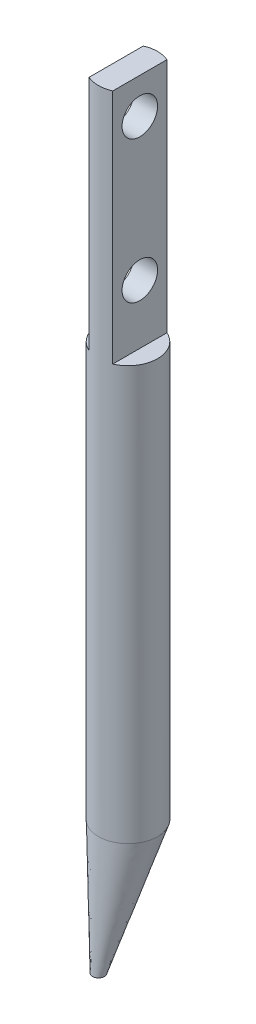
from build123d import *

# Parameters (mm, degrees)
SKETCH1_R               = 2.5
BOSS_EXTRUDE1_DEPTH     = 35
BOSS_EXTRUDE3_DEPTH     = 20
CUT_EXTRUDE1_DEPTH      = 56.192843751
CUT_EXTRUDE1_DEPTH_BACK = 56.192843751
SKETCH5_R               = 1.5


with BuildPart() as part:
    # Sketch1 → Boss-Extrude1 (new body)
    with BuildSketch(Plane(origin=(0, 0, 0), x_dir=(1, 0, 0), z_dir=(0, 1, 0))):
        with Locations(Location((0, 0, 0), (0, 0, 270))):
            Circle(SKETCH1_R)
    extrude(amount=BOSS_EXTRUDE1_DEPTH)

    # Loft1: read off the stored shape, not the designer's step
    # Loft1: loft between two sections, ruled curve by curve
    loft1_from = [
        Edge.make_bspline([(0.230578893, 0, -2.489343965), (0.438024223, 0, -2.470129057), (0.670349848, 0, -2.423167801), (1.166394246, 0, -2.227248431), (1.430985782, 0, -2.076870435), (1.925153205, 0, -1.629385237), (2.153143915, 0, -1.329570714), (2.380909567, 0, -0.787220671), (2.437565935, 0, -0.59190362), (2.50144736, 0, -0.186651247), (2.508558872, 0, 0.023133562), (2.470129057, 0, 0.438024223), (2.42460592, 0, 0.642933676), (2.287375849, 0, 1.029557822), (2.195808172, 0, 1.211145418), (1.87230042, 0, 1.702433007), (1.593119599, 0, 1.955270072), (1.02516693, 0, 2.304374943), (0.737456018, 0, 2.403595168), (0.213865128, 0, 2.505069424), (-0.023133562, 0, 2.508558872), (-0.438024223, 0, 2.470129057), (-0.670349848, 0, 2.423167801), (-1.166394246, 0, 2.227248431), (-1.430985782, 0, 2.076870435), (-1.925153205, 0, 1.629385237), (-2.153143915, 0, 1.329570714), (-2.380909567, 0, 0.787220671), (-2.437565935, 0, 0.59190362), (-2.50144736, 0, 0.186651247), (-2.508558872, 0, -0.023133562), (-2.470129057, 0, -0.438024223), (-2.42460592, 0, -0.642933676), (-2.287375849, 0, -1.029557822), (-2.195808172, 0, -1.211145418), (-1.87230042, 0, -1.702433007), (-1.593119599, 0, -1.955270072), (-1.02516693, 0, -2.304374943), (-0.737456018, 0, -2.403595168), (-0.213865128, 0, -2.505069424), (0.023133562, 0, -2.508558872), (0.230578893, 0, -2.489343965)], [0, 0, 0, 0, 0.0625, 0.0625, 0.125, 0.125, 0.1875, 0.1875, 0.21875, 0.21875, 0.25, 0.25, 0.28125, 0.28125, 0.3125, 0.3125, 0.375, 0.375, 0.4375, 0.4375, 0.5, 0.5, 0.5625, 0.5625, 0.625, 0.625, 0.6875, 0.6875, 0.71875, 0.71875, 0.75, 0.75, 0.78125, 0.78125, 0.8125, 0.8125, 0.875, 0.875, 0.9375, 0.9375, 1, 1, 1, 1], 3),
    ]
    loft1_to = [
        Edge.make_bspline([(0, -10, 2), (0.041666667, -10, 2), (0.0888, -10, 2.005066667), (0.1912, -10, 2.034933333), (0.246666667, -10, 2.06), (0.353333333, -10, 2.14), (0.404267589, -10, 2.19550173), (0.459630911, -10, 2.299307958), (0.474336794, -10, 2.337298155), (0.494521338, -10, 2.416810842), (0.5, -10, 2.458333333), (0.5, -10, 2.541666667), (0.494521338, -10, 2.583189158), (0.474336794, -10, 2.662701845), (0.459630911, -10, 2.700692042), (0.404267589, -10, 2.80449827), (0.353333333, -10, 2.86), (0.246666667, -10, 2.94), (0.1912, -10, 2.965066667), (0.0888, -10, 2.994933333), (0.041666667, -10, 3), (-0.041666667, -10, 3), (-0.0888, -10, 2.994933333), (-0.1912, -10, 2.965066667), (-0.246666667, -10, 2.94), (-0.353333333, -10, 2.86), (-0.404267589, -10, 2.80449827), (-0.459630911, -10, 2.700692042), (-0.474336794, -10, 2.662701845), (-0.494521338, -10, 2.583189158), (-0.5, -10, 2.541666667), (-0.5, -10, 2.458333333), (-0.494521338, -10, 2.416810842), (-0.474336794, -10, 2.337298155), (-0.459630911, -10, 2.299307958), (-0.404267589, -10, 2.19550173), (-0.353333333, -10, 2.14), (-0.246666667, -10, 2.06), (-0.1912, -10, 2.034933333), (-0.0888, -10, 2.005066667), (-0.041666667, -10, 2), (0, -10, 2)], [0, 0, 0, 0, 0.0625, 0.0625, 0.125, 0.125, 0.1875, 0.1875, 0.21875, 0.21875, 0.25, 0.25, 0.28125, 0.28125, 0.3125, 0.3125, 0.375, 0.375, 0.4375, 0.4375, 0.5, 0.5, 0.5625, 0.5625, 0.625, 0.625, 0.6875, 0.6875, 0.71875, 0.71875, 0.75, 0.75, 0.78125, 0.78125, 0.8125, 0.8125, 0.875, 0.875, 0.9375, 0.9375, 1, 1, 1, 1], 3),
    ]
    loft1 = Solid(Shell([*[Face.make_surface_from_curves(loft1_from[k], loft1_to[k]) for k in range(1)], Face(Wire(loft1_from)), Face(Wire(loft1_to))]))
    add(loft1)

    # Sketch4 → Boss-Extrude3 (add)
    with BuildSketch(Plane(origin=(0, 35, 0), x_dir=(1, 0, 0), z_dir=(0, 1, 0))):
        with BuildLine():
            Line((-1, 2.291287847), (-1, -2.291287847))
            ThreePointArc((-1, -2.291287847), (0, -2.5), (1, -2.291287847))
            Line((1, -2.291287847), (1, 2.291287847))
            ThreePointArc((1, 2.291287847), (0, 2.5), (-1, 2.291287847))
        make_face()
    extrude(amount=BOSS_EXTRUDE3_DEPTH)

    # Sketch5 → Cut-Extrude1 (cut, two sides: drawn at the far end of the back side and taken through both)
    with BuildSketch(Plane.ZY.offset(1).offset(-CUT_EXTRUDE1_DEPTH_BACK)):
        with Locations((0, 52)):
            Circle(SKETCH5_R)
        with Locations((0, 40)):
            Circle(SKETCH5_R)
    extrude(amount=CUT_EXTRUDE1_DEPTH + CUT_EXTRUDE1_DEPTH_BACK, mode=Mode.SUBTRACT)


solid = part.part
